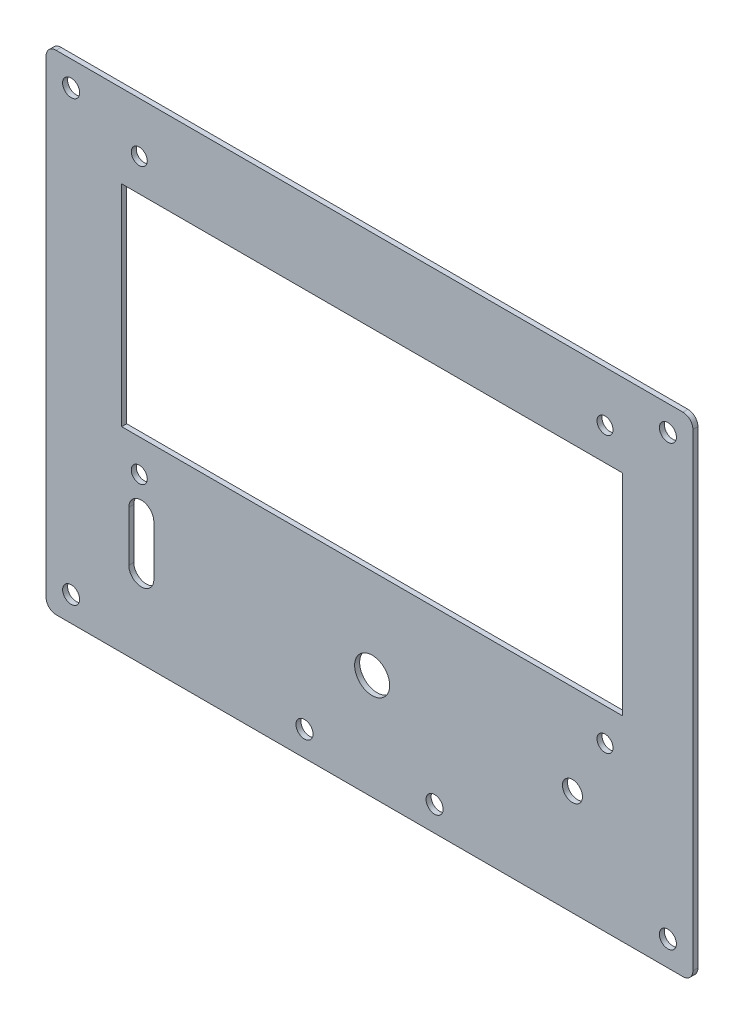
from build123d import *

# Parameters (mm, degrees)
BOSS_EXTRUDE1_OUTLINE_R   = 1.600127185
BOSS_EXTRUDE1_OUTLINE_R_2 = 3.5
BOSS_EXTRUDE1_OUTLINE_R_3 = 2
BOSS_EXTRUDE1_OUTLINE_W   = 100
BOSS_EXTRUDE1_OUTLINE_H   = 42
BOSS_EXTRUDE1_DEPTH       = 1
M3_CLEARANCE_HOLE1_D      = 3.4
M3_CLEARANCE_HOLE1_DEPTH  = 4
M3_CLEARANCE_HOLE1_TIP    = 1.021463052


# Read off the part's stored shape, not the designer's step: Boss-Extrude1
with BuildPart() as part:
    # Boss-Extrude1 outline → Boss-Extrude1 (new body)
    with BuildSketch(Plane.XY):
        with BuildLine():
            ThreePointArc((110.511379674, -48.456994218), (111.925593237, -47.871207781), (112.511379674, -46.456994218))
            Line((112.511379674, -46.456994218), (112.511379674, 47.163183245))
            ThreePointArc((112.511379674, 47.163183245), (111.925593236, 48.577396807), (110.511379674, 49.163183245))
            Line((110.511379674, 49.163183245), (-14.651641589, 49.163183245))
            ThreePointArc((-14.651641589, 49.163183245), (-16.065855151, 48.577396807), (-16.651641589, 47.163183245))
            Line((-16.651641589, 47.163183245), (-16.651641589, -46.456994218))
            ThreePointArc((-16.651641589, -46.456994218), (-16.065855152, -47.871207781), (-14.651641589, -48.456994218))
            Line((-14.651641589, -48.456994218), (110.511379674, -48.456994218))
        make_face()
        with BuildLine():
            Line((4.864408455, -22.627663705), (4.864408455, -32.627663705))
            ThreePointArc((4.864408455, -32.627663705), (2.364408455, -35.127663705), (-0.135591545, -32.627663705))
            Line((-0.135591545, -32.627663705), (-0.135591545, -22.627663705))
            ThreePointArc((-0.135591545, -22.627663705), (2.364408455, -20.127663705), (4.864408455, -22.627663705))
        make_face(mode=Mode.SUBTRACT)
        with Locations((1.954046296, -15.88396989)):
            Circle(BOSS_EXTRUDE1_OUTLINE_R, mode=Mode.SUBTRACT)
        with Locations((48.457742604, -27.384884031)):
            Circle(BOSS_EXTRUDE1_OUTLINE_R_2, mode=Mode.SUBTRACT)
        with Locations((88.460922224, -27.384884031)):
            Circle(BOSS_EXTRUDE1_OUTLINE_R_3, mode=Mode.SUBTRACT)
        with Locations((94.961438913, -15.88396989)):
            Circle(BOSS_EXTRUDE1_OUTLINE_R, mode=Mode.SUBTRACT)
        with Locations((1.954046296, 39.120402088)):
            Circle(BOSS_EXTRUDE1_OUTLINE_R, mode=Mode.SUBTRACT)
        with Locations((48.454046296, 11.620402088)):
            Rectangle(BOSS_EXTRUDE1_OUTLINE_W, BOSS_EXTRUDE1_OUTLINE_H, mode=Mode.SUBTRACT)
        with Locations((94.961438913, 39.120402088)):
            Circle(BOSS_EXTRUDE1_OUTLINE_R, mode=Mode.SUBTRACT)
    extrude(amount=BOSS_EXTRUDE1_DEPTH)

    # M3 Clearance Hole1
    with Locations(Plane.XY.offset(1)):
        with Locations((-11.651641589, 44.163183245), (-11.651641589, -43.456994218), (107.511379674, -43.456994218), (107.511379674, 44.163183245), (34.949251299, -43.456994218), (60.929869042, -43.456994218)):
            Hole(M3_CLEARANCE_HOLE1_D / 2, depth=M3_CLEARANCE_HOLE1_DEPTH)
            with Locations((0, 0, -(M3_CLEARANCE_HOLE1_DEPTH + M3_CLEARANCE_HOLE1_TIP / 2))):  # 118° drill point
                Cone(0, M3_CLEARANCE_HOLE1_D / 2, M3_CLEARANCE_HOLE1_TIP, mode=Mode.SUBTRACT)


solid = part.part
